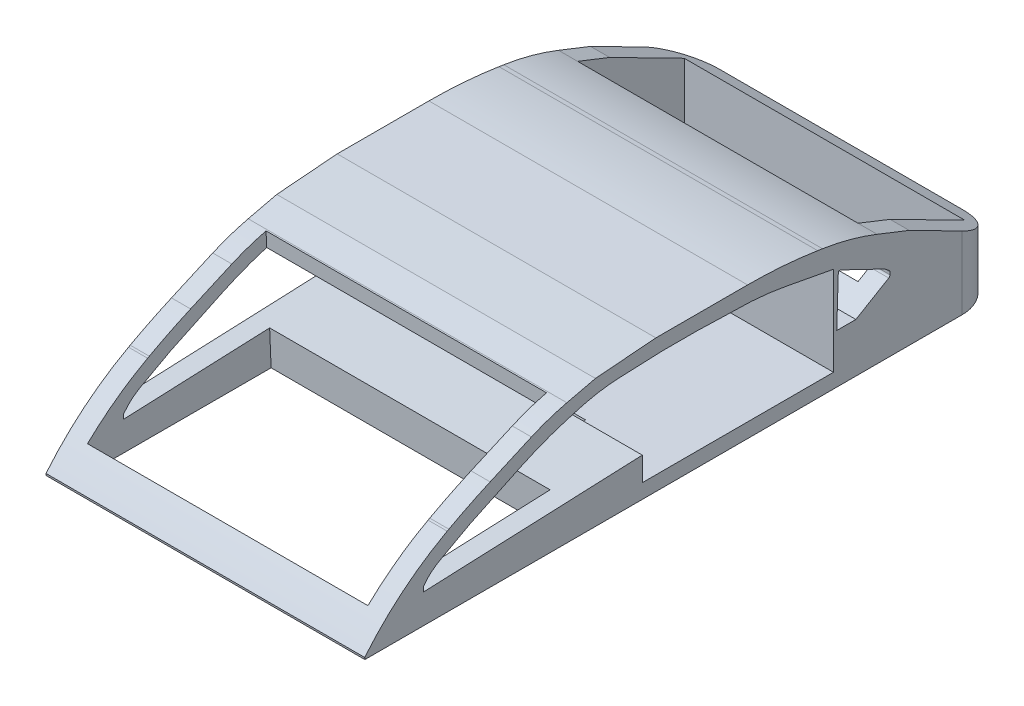
from build123d import *

# Parameters (mm, degrees)
BOSS_EXTRUDE1_DEPTH = 125
CUT_EXTRUDE1_DEPTH  = 402.798830122
CUT_EXTRUDE2_START  = 7.5
CUT_EXTRUDE2_DEPTH  = 110
CUT_EXTRUDE3_START  = 7.5
CUT_EXTRUDE3_DEPTH  = 110
CUT_EXTRUDE4_REACH  = 265.278
SKETCH6_W           = 70.076051312
SKETCH6_H           = 19.92290321
CUT_EXTRUDE5_REACH  = 297.109
SKETCH5_W           = 70
SKETCH5_H           = 20.313376992
CUT_EXTRUDE6_REACH  = 337.806
SKETCH7_W           = 70
SKETCH7_H           = 10
FILLET1_R           = 15
CUT_EXTRUDE7_START  = -125
CUT_EXTRUDE7_DEPTH  = 125
CHAMFER1_START      = 101
CHAMFER1_OUTLINE_W  = 127
CHAMFER1_OUTLINE_H  = 4
CHAMFER1_DEPTH      = 1.291551205


with BuildPart() as part:
    # Sketch1 → Boss-Extrude1 (new body)
    with BuildSketch(Plane(origin=(0, 0, 0), x_dir=(0, 0, -1), z_dir=(1, 0, 0))):
        with BuildLine():
            Line((89.8548345, 121.890508387), (339.8548345, 121.890508387))
            Line((339.8548345, 121.890508387), (339.8548345, 142.698803067))
            Line((339.8548345, 142.698803067), (328.974757131, 148.244473571))
            Line((328.974757131, 148.244473571), (304.07146893, 160.937897169))
            Line((304.07146893, 160.937897169), (291.499350701, 165.900575417))
            ThreePointArc((291.499350701, 165.900575417), (280.939522904, 169.403551358), (270.055923817, 171.711813574))
            Line((270.055923817, 171.711813574), (268.171463935, 172.003048284))
            ThreePointArc((268.171463935, 172.003048284), (254.466056361, 173.586145336), (240.679656072, 174.114879761))
            Line((240.679656072, 174.114879761), (232.021178794, 174.114879761))
            Line((232.021178794, 174.114879761), (204.700095622, 174.114879761))
            Line((204.700095622, 174.114879761), (181.005704906, 172.180643784))
            Line((181.005704906, 172.180643784), (169.793278807, 169.525069181))
            ThreePointArc((169.793278807, 169.525069181), (162.738148163, 167.508293641), (155.897481651, 164.85357451))
            Line((155.897481651, 164.85357451), (139.701268702, 157.697108323))
            ThreePointArc((139.701268702, 157.697108323), (131.522677332, 153.88092637), (123.507487012, 149.732513946))
            Line((123.507487012, 149.732513946), (122.849499947, 149.374661332))
            ThreePointArc((122.849499947, 149.374661332), (105.217865801, 137.440006065), (90.215677989, 122.332230589))
            Line((90.215677989, 122.332230589), (89.8548345, 121.890508387))
        make_face()
    extrude(amount=BOSS_EXTRUDE1_DEPTH)

    # Sketch2 → Cut-Extrude1 (cut, through all)
    with BuildSketch(Plane(origin=(125, 0, 0), x_dir=(0, 0, -1), z_dir=(1, 0, 0))):
        with BuildLine():
            Line((113.475739659, 133.359325966), (201.174236889, 137.018348058))
            Line((201.174236889, 137.018348058), (207.075885424, 168.415118264))
            Line((207.075885424, 168.415118264), (192.666474105, 167.813918061))
            Line((192.666474105, 167.813918061), (190.829871081, 167.73728994))
            ThreePointArc((190.829871081, 167.73728994), (182.233808887, 166.844681368), (173.813252446, 164.899619793))
            Line((173.813252446, 164.899619793), (169.2892062, 163.555605085))
            ThreePointArc((169.2892062, 163.555605085), (160.569837528, 160.5967142), (152.103009161, 156.977979241))
            Line((152.103009161, 156.977979241), (131.888883088, 147.40524948))
            Line((131.888883088, 147.40524948), (120.054289503, 140.950016615))
            ThreePointArc((120.054289503, 140.950016615), (116.601738736, 138.565427019), (113.722697716, 135.512969462))
            Line((113.722697716, 135.512969462), (113.475739659, 135.188837012))
            Line((113.475739659, 135.188837012), (113.475739659, 133.359325966))
        make_face()
        with BuildLine():
            Line((221.003775967, 168.415118264), (218.761149524, 138.906875589))
            Line((218.761149524, 138.906875589), (272.584184163, 138.906875589))
            Line((272.584184163, 138.906875589), (274.383679522, 162.58444611))
            Line((274.383679522, 162.58444611), (267.028526617, 163.966993649))
            Line((267.028526617, 163.966993649), (257.016670223, 165.848921543))
            Line((257.016670223, 165.848921543), (255.744876296, 166.087980551))
            ThreePointArc((255.744876296, 166.087980551), (245.628472921, 167.506912168), (235.424062848, 167.981253005))
            Line((235.424062848, 167.981253005), (234.695600568, 167.981253005))
            Line((234.695600568, 167.981253005), (221.003775967, 168.415118264))
        make_face()
        with BuildLine():
            Line((276.275786009, 160.987395212), (275.646964577, 141.143186512))
            Line((275.646964577, 141.143186512), (283.14790924, 141.143186512))
            Line((283.14790924, 141.143186512), (294.416525801, 147.803376186))
            Line((294.416525801, 147.803376186), (296.046101937, 148.766518919))
            ThreePointArc((296.046101937, 148.766518919), (296.405855365, 149.13182216), (296.537289859, 149.627396535))
            Line((296.537289859, 149.627396535), (296.537289859, 150.540124257))
            ThreePointArc((296.537289859, 150.540124257), (296.433404588, 150.983946735), (296.143333074, 151.335555977))
            Line((296.143333074, 151.335555977), (294.416525801, 152.651218661))
            Line((294.416525801, 152.651218661), (277.097452917, 160.987395212))
            Line((277.097452917, 160.987395212), (276.275786009, 160.987395212))
        make_face()
    extrude(amount=-CUT_EXTRUDE1_DEPTH, mode=Mode.SUBTRACT)

    # Cut-Extrude2: read off the stored shape, not the designer's step
    # Cut-Extrude2 outline → Cut-Extrude2 (cut)
    with BuildSketch(Plane.YZ.offset(CUT_EXTRUDE2_START)):
        with BuildLine():
            Line((121.890508387, -99.688159251), (121.890508387, -171.289102204))
            Line((121.890508387, -171.289102204), (135.747336393, -170.710957294))
            Line((135.747336393, -170.710957294), (133.359325966, -113.475739659))
            Line((133.359325966, -113.475739659), (135.188837012, -113.475739659))
            Line((135.188837012, -113.475739659), (135.512969462, -113.722697716))
            ThreePointArc((135.512969462, -113.722697716), (138.565427019, -116.601738736), (140.950016615, -120.054289503))
            Line((140.950016615, -120.054289503), (147.40524948, -131.888883088))
            Line((147.40524948, -131.888883088), (156.977979241, -152.103009161))
            ThreePointArc((156.977979241, -152.103009161), (160.5967142, -160.569837528), (163.555605085, -169.2892062))
            Line((163.555605085, -169.2892062), (163.632345036, -169.547518172))
            Line((163.632345036, -169.547518172), (169.408178174, -169.306534555))
            ThreePointArc((169.408178174, -169.306534555), (167.428165725, -162.501028912), (164.85357451, -155.897481651))
            Line((164.85357451, -155.897481651), (157.697108323, -139.701268702))
            ThreePointArc((157.697108323, -139.701268702), (153.88092637, -131.522677332), (149.732513946, -123.507487012))
            Line((149.732513946, -123.507487012), (149.374661332, -122.849499947))
            ThreePointArc((149.374661332, -122.849499947), (141.537958861, -110.480020928), (132.127738515, -99.261033903))
            Line((132.127738515, -99.261033903), (121.890508387, -99.688159251))
        make_face()
    extrude(amount=CUT_EXTRUDE2_DEPTH, mode=Mode.SUBTRACT)

    # Cut-Extrude3: read off the stored shape, not the designer's step
    # Cut-Extrude3 outline → Cut-Extrude3 (cut)
    with BuildSketch(Plane.YZ.offset(CUT_EXTRUDE3_START)):
        with BuildLine():
            Line((121.890508387, -291.499350701), (121.890508387, -333.35633566))
            Line((121.890508387, -333.35633566), (146.011144709, -333.35633566))
            Line((146.011144709, -333.35633566), (160.937897169, -304.07146893))
            Line((160.937897169, -304.07146893), (165.900575417, -291.499350701))
            Line((165.900575417, -291.499350701), (154.055340396, -291.499350701))
            Line((154.055340396, -291.499350701), (152.651218661, -294.416525801))
            Line((152.651218661, -294.416525801), (151.335555977, -296.143333074))
            ThreePointArc((151.335555977, -296.143333074), (150.983946735, -296.433404588), (150.540124257, -296.537289859))
            Line((150.540124257, -296.537289859), (149.627396535, -296.537289859))
            ThreePointArc((149.627396535, -296.537289859), (149.13182216, -296.405855365), (148.766518919, -296.046101937))
            Line((148.766518919, -296.046101937), (146.079212499, -291.499350701))
            Line((146.079212499, -291.499350701), (121.890508387, -291.499350701))
        make_face()
    extrude(amount=CUT_EXTRUDE3_DEPTH, mode=Mode.SUBTRACT)

    # Cut-Extrude4: up to this plane
    cut_extrude4_end = Plane(origin=(0, 137.018348058, -201.174236889), z_dir=(0, -0.18473466771426061, -0.9827884322398701))
    # Sketch6 → Cut-Extrude4 (cut, up to the surface)
    with BuildSketch(Plane(origin=(0, -15.732649467, -207.008545619), x_dir=(-1, 0, 0), z_dir=(0, -0.07578145826840303, -0.9971244509000441)), mode=Mode.PRIVATE) as cut_extrude4_sk1:
        with Locations((-57.714978641, 162.925898332)):
            Rectangle(SKETCH6_W, SKETCH6_H)
    cut_extrude4_tool1 = split(extrude(cut_extrude4_sk1.sketch, amount=-CUT_EXTRUDE4_REACH, mode=Mode.PRIVATE), bisect_by=cut_extrude4_end, keep=Keep.BOTH, mode=Mode.PRIVATE)
    add(cut_extrude4_tool1.solids().sort_by_distance((57.714979, 146.724747, -219.355308))[0], mode=Mode.SUBTRACT)

    # Cut-Extrude5: up to this plane
    cut_extrude5_end = Plane(origin=(0, 168.415118264, -221.003775967), z_dir=(0, 0.075781458268403, 0.997124450900044))
    # Sketch5 → Cut-Extrude5 (cut, up to the surface)
    with BuildSketch(Plane(origin=(0, -31.848196468, -169.432405211), x_dir=(1, 0, 0), z_dir=(0, 0.18473466771426064, 0.9827884322398701)), mode=Mode.PRIVATE) as cut_extrude5_sk1:
        with Locations((57.5, 181.980591777)):
            Rectangle(SKETCH5_W, SKETCH5_H)
    cut_extrude5_tool1 = split(extrude(cut_extrude5_sk1.sketch, amount=-CUT_EXTRUDE5_REACH, mode=Mode.PRIVATE), bisect_by=cut_extrude5_end, keep=Keep.BOTH, mode=Mode.PRIVATE)
    add(cut_extrude5_tool1.solids().sort_by_distance((57.5, 147.000224, -203.050529))[0], mode=Mode.SUBTRACT)

    # Cut-Extrude6: up to this plane
    cut_extrude6_end = Plane(origin=(125, 121.890508387, -89.8548345), z_dir=(0, 1, 0))
    # Sketch7 → Cut-Extrude6 (cut, up to the surface)
    with BuildSketch(Plane(origin=(0, 168.866544526, -31.741831678), x_dir=(1, 0, 0), z_dir=(0, 0.9827884322398701, -0.18473466771426067)), mode=Mode.PRIVATE) as cut_extrude6_sk1:
        with Locations((57.5, 177.39967388)):
            Rectangle(SKETCH7_W, SKETCH7_H)
    cut_extrude6_tool1 = split(extrude(cut_extrude6_sk1.sketch, amount=-CUT_EXTRUDE6_REACH, mode=Mode.PRIVATE), bisect_by=cut_extrude6_end, keep=Keep.BOTH, mode=Mode.PRIVATE)
    add(cut_extrude6_tool1.solids().sort_by_distance((57.5, 136.094675, -206.088179))[0], mode=Mode.SUBTRACT)

    # Fillet1
    fillet1_edges = [part.edges().sort_by_distance(p)[0] for p in [
        (125, 132.294655727, -339.8548345),
        (0, 132.294655727, -339.8548345),
    ]]
    fillet(fillet1_edges, radius=FILLET1_R)

    # Sketch14 → Cut-Extrude7 (cut)
    with BuildSketch(Plane(origin=(125, 0, 0), x_dir=(0, 0, -1), z_dir=(1, 0, 0)).offset(CUT_EXTRUDE7_START)):
        Polygon((221.003775967, 168.415118264), (207.075885424, 168.415118264), (199.383679522, 168.094178314), (199.383679522, 127.58444611), (274.383679522, 127.58444611), (274.383679522, 162.58444611), (255.744876296, 166.087980551), (245.628472921, 167.506912168), (235.059831708, 167.981253005), (234.695600568, 167.981253005), align=None)
    extrude(amount=CUT_EXTRUDE7_DEPTH, mode=Mode.SUBTRACT)

    # Chamfer1: read off the stored shape, not the designer's step
    # Chamfer1 outline → Chamfer1 (cut)
    with BuildSketch(Plane(origin=(0, 0, 0), x_dir=(1, 0, 0), z_dir=(0, 0.09991010561593, -0.99499646773032)).offset(CHAMFER1_START)):
        with Locations((62.5, -113)):
            Rectangle(CHAMFER1_OUTLINE_W, CHAMFER1_OUTLINE_H)
    extrude(amount=CHAMFER1_DEPTH, mode=Mode.SUBTRACT)


solid = part.part
